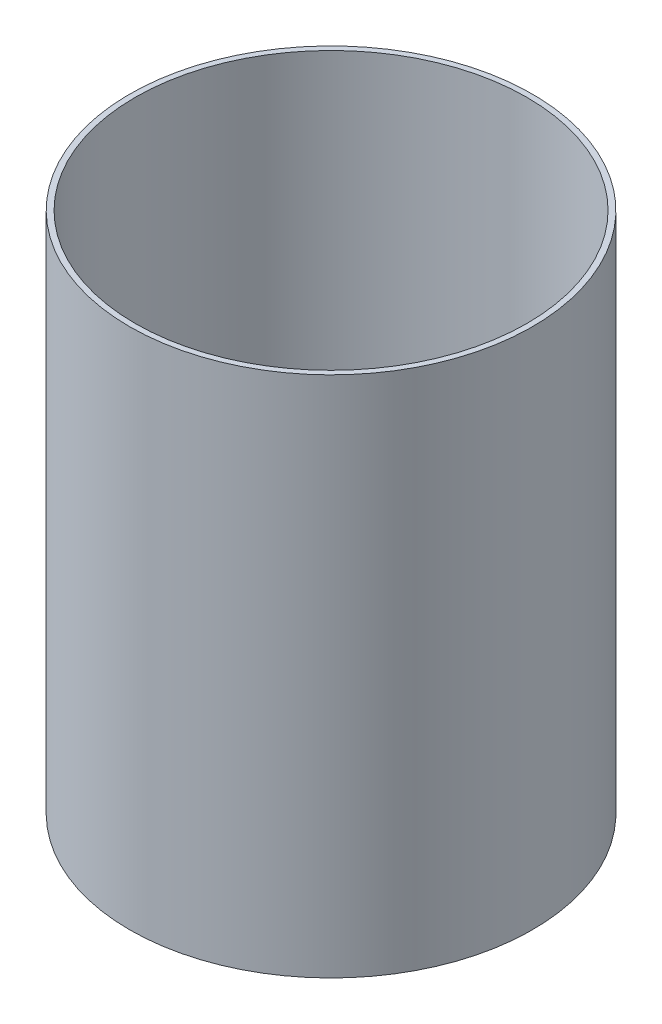
from build123d import *

# Parameters (mm, degrees)
SKETCH1_R           = 78.359
SKETCH1_R_2         = 76.2
BOSS_EXTRUDE1_DEPTH = 203.2


with BuildPart() as part:
    # Sketch1 → Boss-Extrude1 (new body)
    with BuildSketch(Plane(origin=(0, 0, 0), x_dir=(1, 0, 0), z_dir=(0, 1, 0))):
        Circle(SKETCH1_R)
        Circle(SKETCH1_R_2, mode=Mode.SUBTRACT)
    extrude(amount=BOSS_EXTRUDE1_DEPTH)


solid = part.part
